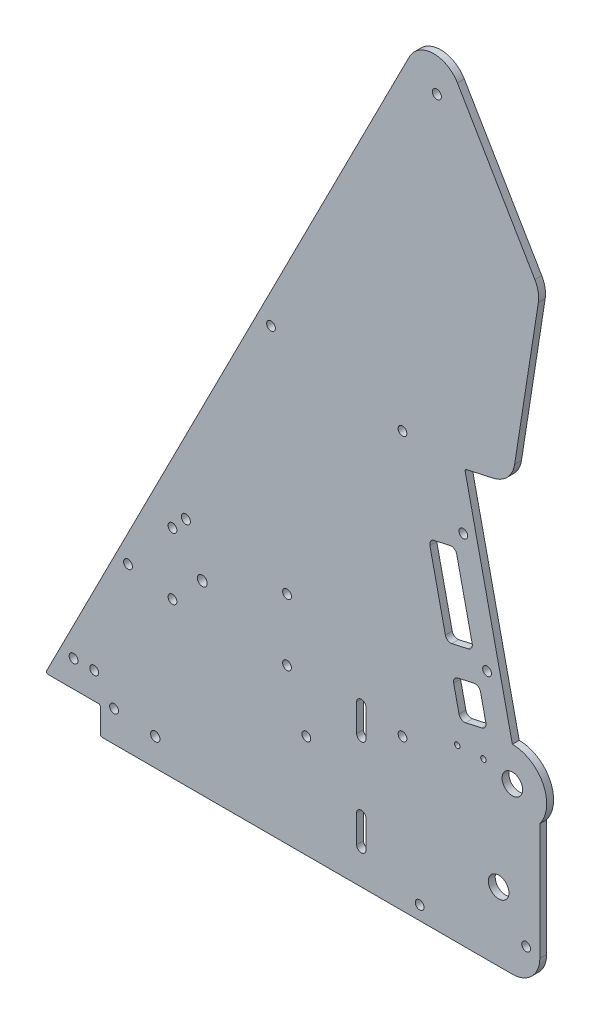
from build123d import *

# Parameters (mm, degrees)
BOSS_EXTRUDE1_DEPTH     = 3.175
SKETCH2_R               = 2.0955
SKETCH2_R_2             = 2.286
SKETCH2_R_3             = 2.032
SKETCH2_R_4             = 4.7625
CUT_EXTRUDE1_DEPTH      = 421.976111717
SKETCH7_R               = 2.159
CUT_EXTRUDE2_DEPTH      = 421.976111717
CUT_EXTRUDE3_REACH      = 422.976
SKETCH10_R              = 2.032
FILLET1_R               = 12.7
FILLET2_R               = 0.79375
SKETCH12_R              = 2.032
CUT_EXTRUDE5_DEPTH      = 410.593447353
SKETCH13_R              = 2.032
CUT_EXTRUDE6_DEPTH      = 410.593447353
CUT_EXTRUDE7_DEPTH      = 410.593447353
CUT_EXTRUDE7_DEPTH_BACK = 410.593447353
SKETCH14_R              = 1.27
FILLET3_R               = 2.54


with BuildPart() as part:
    # Sketch1 → Boss-Extrude1 (new body)
    with BuildSketch(Plane.XY):
        with BuildLine():
            Line((228.6, -12.7), (228.6, 53.975))
            ThreePointArc((228.6, 53.975), (230.099031657, 70.599515829), (215.9, 79.375))
            Line((215.9, 79.375), (193.909735224, 178.566674323))
            Line((193.909735224, 178.566674323), (215.607913982, 183.377044743))
            Line((215.607913982, 183.377044743), (228.6, 266.7))
            Line((228.6, 266.7), (178.754725958, 351.413083686))
            Line((178.754725958, 351.413083686), (0, 0))
            Line((0, 0), (25.4, 0))
            Line((25.4, 0), (25.4, -12.7))
            Line((25.4, -12.7), (228.6, -12.7))
        make_face()
    extrude(amount=BOSS_EXTRUDE1_DEPTH)

    # Sketch2 → Cut-Extrude1 (cut, through all)
    with BuildSketch(Plane.XY.offset(3.175)):
        with Locations((64.943150167, 94.057839899)):
            Circle(SKETCH2_R)
        with Locations((180.975, 322.164313376)):
            Circle(SKETCH2_R)
        with Locations((72.544547852, 73.173171402)):
            Circle(SKETCH2_R_2)
        with Locations((193.207821773, 152.394364194)):
            Circle(SKETCH2_R_3)
        with Locations((215.9, 63.5)):
            Circle(SKETCH2_R_4)
        with Locations((173.0375, -6.35)):
            Circle(SKETCH2_R_3)
        with Locations((204.202954161, 102.798527032)):
            Circle(SKETCH2_R_3)
        with Locations((209.55, 19.05)):
            Circle(SKETCH2_R_4)
        with Locations((165.1, 179.3875)):
            Circle(SKETCH2_R_3)
        with Locations((111.724047852, 87.460671402)):
            Circle(SKETCH2_R_3)
        with Locations((111.724047852, 58.885671402)):
            Circle(SKETCH2_R_3)
        with Locations((58.765047852, 58.885671402)):
            Circle(SKETCH2_R_3)
        with Locations((58.765047852, 87.460671402)):
            Circle(SKETCH2_R_3)
    extrude(amount=-CUT_EXTRUDE1_DEPTH, mode=Mode.SUBTRACT)

    # Sketch7 → Cut-Extrude2 (cut, through all)
    with BuildSketch(Plane.XY.offset(3.175)):
        with Locations((50.8, 0)):
            Circle(SKETCH7_R)
        with BuildLine():
            Line((143.891, 3.175), (143.891, 15.875))
            ThreePointArc((143.891, 15.875), (146.05, 18.034), (148.209, 15.875))
            Line((148.209, 15.875), (148.209, 3.175))
            ThreePointArc((148.209, 3.175), (146.05, 1.016), (143.891, 3.175))
        make_face()
        with BuildLine():
            Line((143.891, 47.625), (143.891, 60.325))
            ThreePointArc((143.891, 60.325), (146.05, 62.484), (148.209, 60.325))
            Line((148.209, 60.325), (148.209, 47.625))
            ThreePointArc((148.209, 47.625), (146.05, 45.466), (143.891, 47.625))
        make_face()
    extrude(amount=-CUT_EXTRUDE2_DEPTH, mode=Mode.SUBTRACT)

    # Sketch10 → Cut-Extrude3 (cut, up to next)
    with BuildSketch(Plane.XY.offset(3.175), mode=Mode.PRIVATE) as cut_extrude3_sk1:
        with Locations((120.65, 34.925)):
            Circle(SKETCH10_R)
    cut_extrude3_tool1 = extrude(cut_extrude3_sk1.sketch, amount=-CUT_EXTRUDE3_REACH, mode=Mode.PRIVATE) & part.part
    # Sketch10 → Cut-Extrude3 (cut, up to next)
    with BuildSketch(Plane.XY.offset(3.175), mode=Mode.PRIVATE) as cut_extrude3_sk2:
        with Locations((165.1, 57.15)):
            Circle(SKETCH10_R)
    cut_extrude3_tool2 = extrude(cut_extrude3_sk2.sketch, amount=-CUT_EXTRUDE3_REACH, mode=Mode.PRIVATE) & part.part
    # Sketch10 → Cut-Extrude3 (cut, up to next)
    with BuildSketch(Plane.XY.offset(3.175), mode=Mode.PRIVATE) as cut_extrude3_sk3:
        with Locations((13.046467246, 12.334704411)):
            Circle(SKETCH10_R)
    cut_extrude3_tool3 = extrude(cut_extrude3_sk3.sketch, amount=-CUT_EXTRUDE3_REACH, mode=Mode.PRIVATE) & part.part
    # Sketch10 → Cut-Extrude3 (cut, up to next)
    with BuildSketch(Plane.XY.offset(3.175), mode=Mode.PRIVATE) as cut_extrude3_sk4:
        with Locations((22.571467246, 12.334704411)):
            Circle(SKETCH10_R)
    cut_extrude3_tool4 = extrude(cut_extrude3_sk4.sketch, amount=-CUT_EXTRUDE3_REACH, mode=Mode.PRIVATE) & part.part
    # Sketch10 → Cut-Extrude3 (cut, up to next)
    with BuildSketch(Plane.XY.offset(3.175), mode=Mode.PRIVATE) as cut_extrude3_sk5:
        with Locations((38.211447917, 62.639810909)):
            Circle(SKETCH10_R)
    cut_extrude3_tool5 = extrude(cut_extrude3_sk5.sketch, amount=-CUT_EXTRUDE3_REACH, mode=Mode.PRIVATE) & part.part
    add(cut_extrude3_tool1.solids().sort_by_distance((120.65, 34.925, 3.175))[0], mode=Mode.SUBTRACT)
    add(cut_extrude3_tool2.solids().sort_by_distance((165.1, 57.15, 3.175))[0], mode=Mode.SUBTRACT)
    add(cut_extrude3_tool3.solids().sort_by_distance((13.046467, 12.334704, 3.175))[0], mode=Mode.SUBTRACT)
    add(cut_extrude3_tool4.solids().sort_by_distance((22.571467, 12.334704, 3.175))[0], mode=Mode.SUBTRACT)
    add(cut_extrude3_tool5.solids().sort_by_distance((38.211448, 62.639811, 3.175))[0], mode=Mode.SUBTRACT)

    # Fillet1
    fillet1_edges = [part.edges().sort_by_distance(p)[0] for p in [
        (228.6, -12.7, 1.5875),
        (178.754725958, 351.413083686, 1.5875),
        (215.607913982, 183.377044743, 1.5875),
        (228.6, 266.7, 1.5875),
    ]]
    fillet(fillet1_edges, radius=FILLET1_R)

    # Fillet2
    fillet2_edges = [part.edges().sort_by_distance(p)[0] for p in [
        (25.4, -12.7, 1.5875),
        (25.4, 0, 1.5875),
        (193.909735224, 178.566674323, 1.5875),
        (0, 0, 1.5875),
    ]]
    fillet(fillet2_edges, radius=FILLET2_R)

    # Sketch12 → Cut-Extrude5 (cut, through all)
    with BuildSketch(Plane.XY.offset(3.175)):
        with Locations((31.75, 1.5875)):
            Circle(SKETCH12_R)
        with Locations((173.0375, -6.35)):
            Circle(SKETCH12_R)
        with Locations((222.25, 1.5875)):
            Circle(SKETCH12_R)
    extrude(amount=-CUT_EXTRUDE5_DEPTH, mode=Mode.SUBTRACT)

    # Sketch13 → Cut-Extrude6 (cut, through all)
    with BuildSketch(Plane.XY.offset(3.175)):
        with Locations((104.321757764, 191.07999269)):
            Circle(SKETCH13_R)
    extrude(amount=-CUT_EXTRUDE6_DEPTH, mode=Mode.SUBTRACT)

    # Sketch14 → Cut-Extrude7 (cut, two sides: drawn at the far end of the back side and taken through both)
    with BuildSketch(Plane.XY.offset(3.175).offset(-CUT_EXTRUDE7_DEPTH_BACK)):
        with Locations((190.426832263, 66.260948917)):
            Circle(SKETCH14_R)
        with Locations((202.533497378, 66.789537331)):
            Circle(SKETCH14_R)
        Polygon((177.223670315, 142.346588213), (189.622629605, 145.09537131), (197.868978896, 107.898493439), (185.470019606, 105.149710342), align=None)
        Polygon((188.218802703, 92.750751051), (200.617761993, 95.499534148), (204.191180019, 79.380887071), (191.792220729, 76.632103974), align=None)
    extrude(amount=CUT_EXTRUDE7_DEPTH + CUT_EXTRUDE7_DEPTH_BACK, mode=Mode.SUBTRACT)

    # Fillet3
    fillet3_edges = [part.edges().sort_by_distance(p)[0] for p in [
        (200.617761993, 95.499534148, 1.5875),
        (188.218802703, 92.750751051, 1.5875),
        (191.792220729, 76.632103974, 1.5875),
        (204.191180019, 79.380887071, 1.5875),
        (197.868978896, 107.898493439, 1.5875),
        (185.470019606, 105.149710342, 1.5875),
        (177.223670315, 142.346588213, 1.5875),
        (189.622629605, 145.09537131, 1.5875),
    ]]
    fillet(fillet3_edges, radius=FILLET3_R)


solid = part.part
